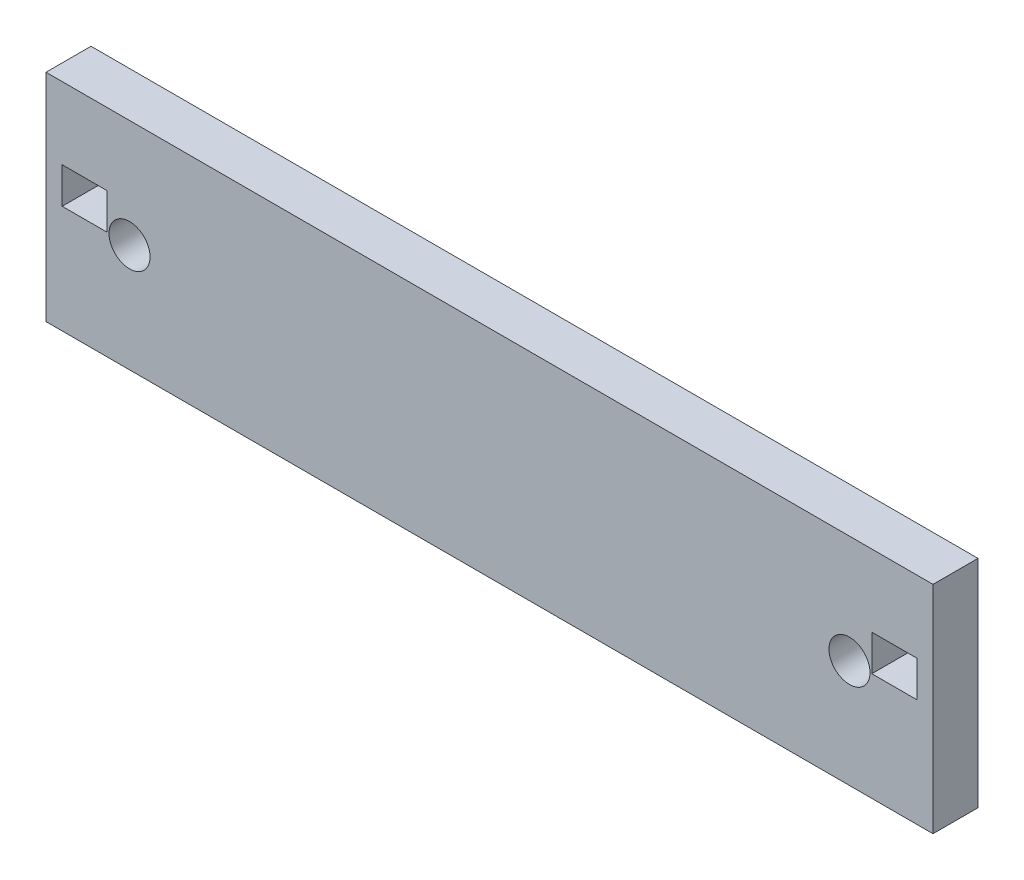
from build123d import *

# Parameters (mm, degrees)
SKETCH1_W           = 31.2928
SKETCH1_H           = 7.62
SKETCH1_R           = 0.7239
SKETCH1_W_2         = 1.5875
SKETCH1_H_2         = 1.27
BOSS_EXTRUDE1_DEPTH = 1.5875


with BuildPart() as part:
    # Sketch1 → Boss-Extrude1 (new body)
    with BuildSketch(Plane.XY):
        with Locations((-2.3876, 0)):
            Rectangle(SKETCH1_W, SKETCH1_H)
        with Locations((-15.0876, 0)):
            Circle(SKETCH1_R, mode=Mode.SUBTRACT)
        with Locations((10.3124, 0)):
            Circle(SKETCH1_R, mode=Mode.SUBTRACT)
        with Locations((-16.66875, 0.635)):
            Rectangle(SKETCH1_W_2, SKETCH1_H_2, mode=Mode.SUBTRACT)
        with Locations((11.89355, 0.635)):
            Rectangle(SKETCH1_W_2, SKETCH1_H_2, mode=Mode.SUBTRACT)
    extrude(amount=BOSS_EXTRUDE1_DEPTH)


solid = part.part
